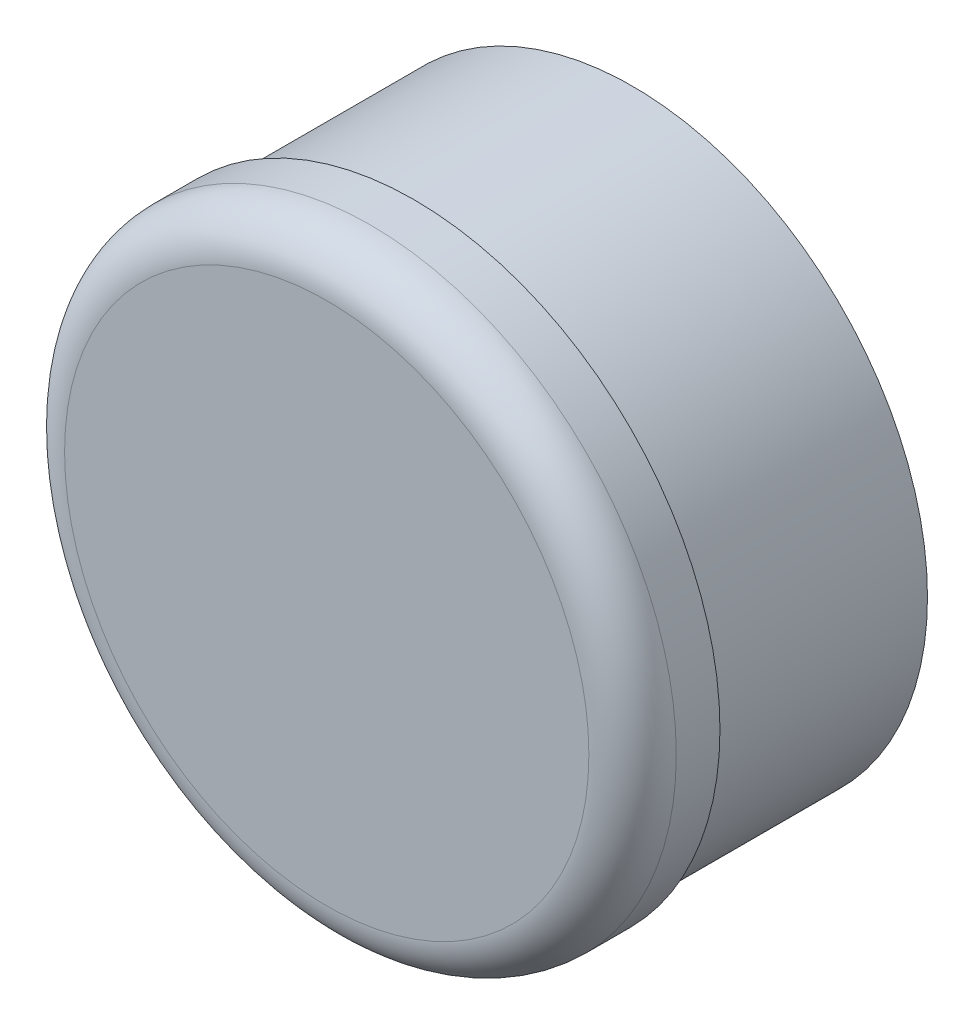
from build123d import *

# Parameters (mm, degrees)
SKETCH_1_R      = 6.75
SKETCH_1_R_2    = 1.75
EXTRUDE_1_DEPTH = 5
SKETCH_2_R      = 7
EXTRUDE_2_DEPTH = 2
FILLET_1_R      = 1


with BuildPart() as part:
    # 草图1 → 凸台-拉伸1 (new body)
    with BuildSketch(Plane.XY):
        Circle(SKETCH_1_R)
        Circle(SKETCH_1_R_2, mode=Mode.SUBTRACT)
    extrude(amount=EXTRUDE_1_DEPTH)

    # 草图2 → 凸台-拉伸2 (add)
    with BuildSketch(Plane.XY.offset(5)):
        Circle(SKETCH_2_R)
    extrude(amount=EXTRUDE_2_DEPTH)

    # 圆角1
    fillet_1_edges = [part.edges().sort_by_distance(p)[0] for p in [
        (-7, 0, 7),
    ]]
    fillet(fillet_1_edges, radius=FILLET_1_R)


solid = part.part
